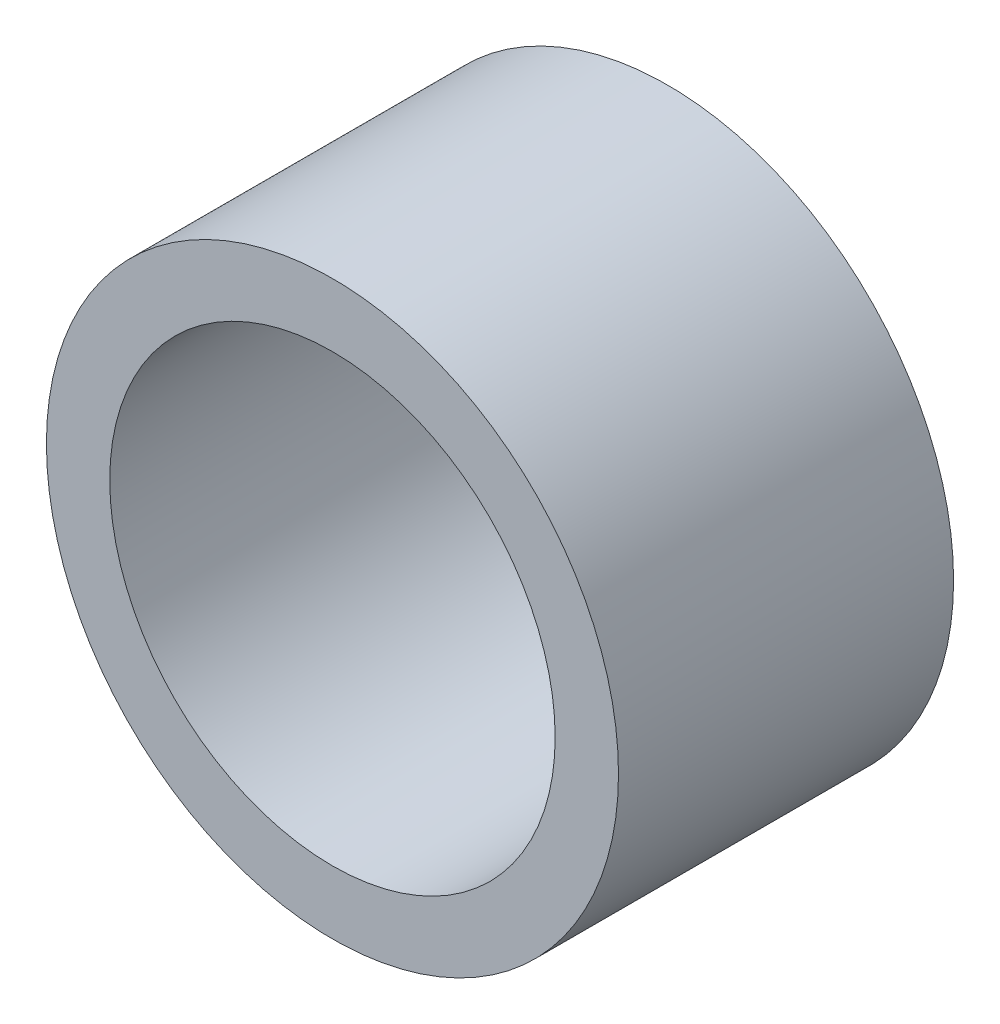
from build123d import *

# Parameters (mm, degrees)
SKETCH1_R           = 3.5
SKETCH1_R_2         = 2.725
BOSS_EXTRUDE1_DEPTH = 4.1


with BuildPart() as part:
    # Sketch1 → Boss-Extrude1 (new body)
    with BuildSketch(Plane.XY):
        Circle(SKETCH1_R)
        Circle(SKETCH1_R_2, mode=Mode.SUBTRACT)
    extrude(amount=BOSS_EXTRUDE1_DEPTH)


solid = part.part
